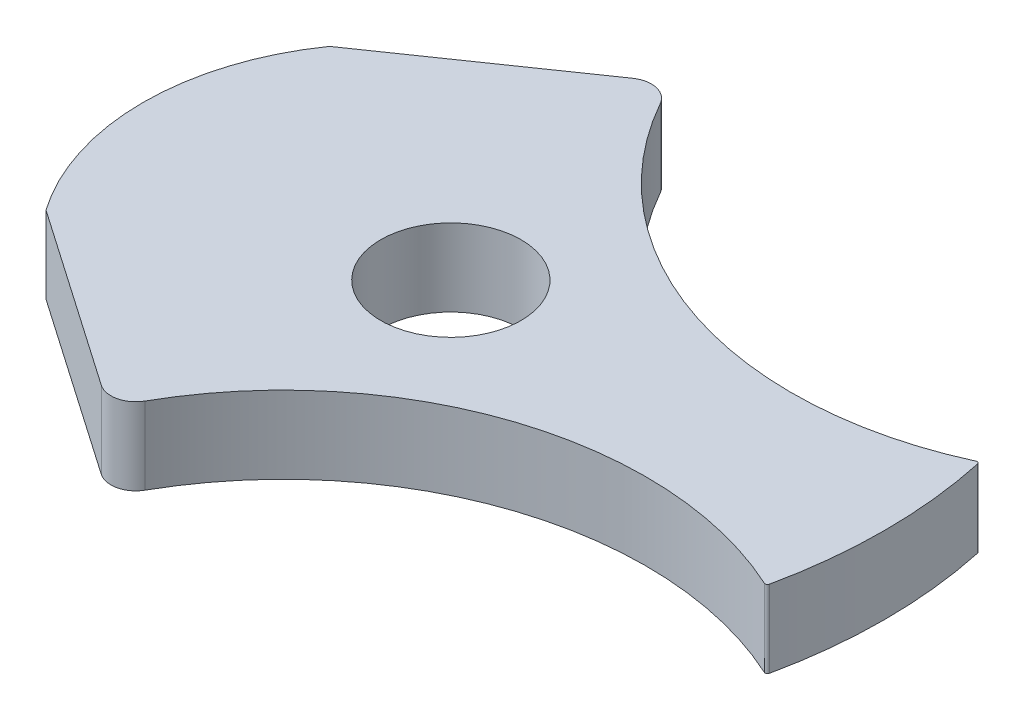
from build123d import *

# Parameters (mm, degrees)
BOSS_EXTRUDE1_DEPTH = 7.9375
FILLET3_R           = 2.54
FILLET4_R           = 2.54
SKETCH3_R           = 7.20725
CUT_EXTRUDE2_DEPTH  = 59.434483679
FILLET5_R           = 0.254


with BuildPart() as part:
    # Sketch1 → Boss-Extrude1 (new body)
    with BuildSketch(Plane(origin=(0, 0, 0), x_dir=(1, 0, 0), z_dir=(0, 1, 0))):
        with BuildLine():
            Line((-20.806461925, 14.568841483), (0, 28.959440013))
            ThreePointArc((0, 28.959440013), (21.077388652, 9.705652005), (49.595837162, 10.995132388))
            ThreePointArc((49.595837162, 10.995132388), (50.8, 0), (49.595837162, -10.995132388))
            ThreePointArc((49.595837162, -10.995132388), (21.077388652, -9.705652005), (0, -28.959440013))
            Line((0, -28.959440013), (-20.806461925, -14.568841483))
            ThreePointArc((-20.806461925, -14.568841483), (-25.4, 0), (-20.806461925, 14.568841483))
        make_face()
    extrude(amount=BOSS_EXTRUDE1_DEPTH)

    # Fillet3
    fillet3_edges = [part.edges().sort_by_distance(p)[0] for p in [
        (0, 3.96875, -28.959440013),
    ]]
    fillet(fillet3_edges, radius=FILLET3_R)

    # Fillet4
    fillet4_edges = [part.edges().sort_by_distance(p)[0] for p in [
        (0, 3.96875, 28.959440013),
    ]]
    fillet(fillet4_edges, radius=FILLET4_R)

    # Sketch3 → Cut-Extrude2 (cut, through all)
    with BuildSketch(Plane.XZ):
        with Locations((6.23189, 0)):
            Circle(SKETCH3_R)
    extrude(amount=-CUT_EXTRUDE2_DEPTH, mode=Mode.SUBTRACT)

    # Fillet5
    fillet5_edges = [part.edges().sort_by_distance(p)[0] for p in [
        (49.595837162, 3.96875, 10.995132388),
        (49.595837162, 3.96875, -10.995132388),
    ]]
    fillet(fillet5_edges, radius=FILLET5_R)


solid = part.part
